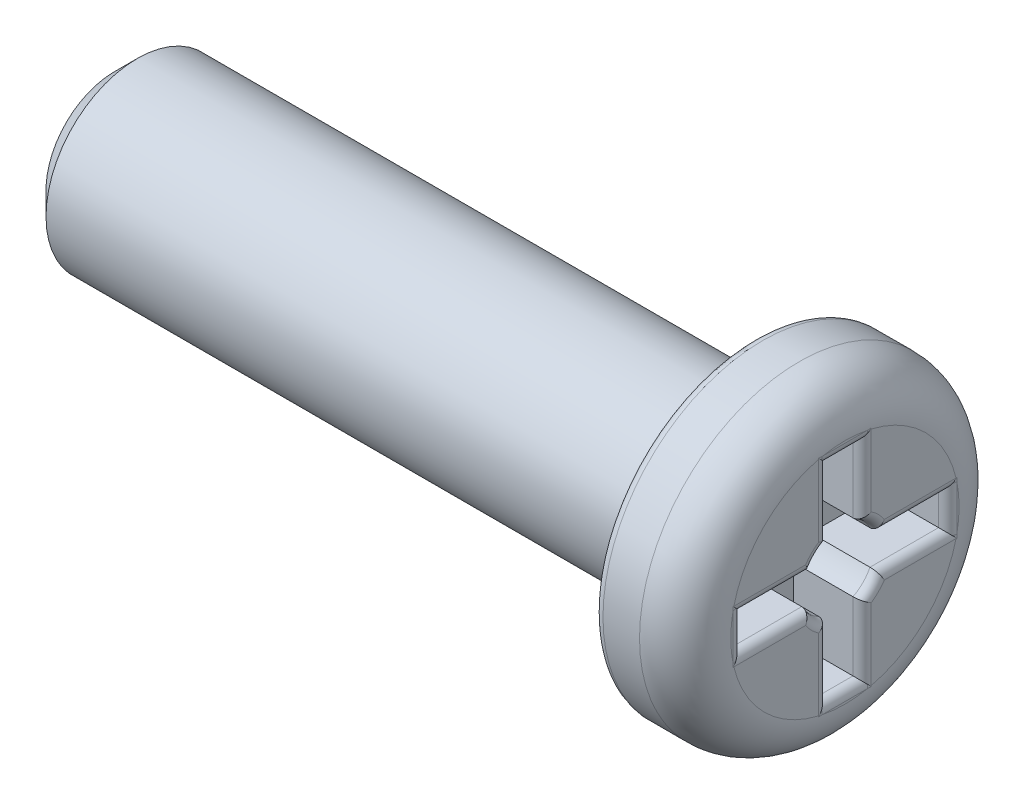
from build123d import *

# Parameters (mm, degrees)
ESQUISSE2_W                  = 0.75
ESQUISSE2_H                  = 2.25
ENL_V_MAT_EXTRU_1_DEPTH      = 1.5
R_P_TITION_CIRCULAIRE1_COUNT = 4
ESQUISSE3_R                  = 0.836492191
ENL_V_MAT_EXTRU_2_DEPTH      = 1.5
CONG_2_R                     = 0.2
CHANFREIN1_SIZE              = 0.5


with BuildPart() as part:
    # Esquisse1 → Révolution1 (revolve)
    with BuildSketch(Plane.XY, mode=Mode.PRIVATE) as r_volution1_sk:
        with BuildLine():
            Line((0, 0), (0, 2))
            Line((0, 2), (14, 2))
            Line((14, 2), (14, 3.5))
            Line((14, 3.5), (15, 3.5))
            ThreePointArc((15, 3.5), (15.707106781, 3.207106781), (16, 2.5))
            Line((16, 2.5), (16, 0))
            Line((16, 0), (0, 0))
        make_face()
    revolve(r_volution1_sk.sketch.rotate(Axis((0, 0, 0), (1, 0, 0)), 90), axis=Axis((0, 0, 0), (1, 0, 0)))

    # Esquisse2 → Enlèv. mat.-Extru.1 (cut)
    with BuildSketch(Plane(origin=(16, 0, 0), x_dir=(0, 0, -1), z_dir=(1, 0, 0))):
        with Locations((0, 1.125)):
            Rectangle(ESQUISSE2_W, ESQUISSE2_H)
    enl_v_mat_extru_1 = extrude(amount=-ENL_V_MAT_EXTRU_1_DEPTH, mode=Mode.SUBTRACT)

    # Répétition circulaire1: Enlèv. mat.-Extru.1 ×4 about axis
    r_p_tition_circulaire1_axis = Axis((0, 0, 0), (1, 0, 0))
    for i in range(1, R_P_TITION_CIRCULAIRE1_COUNT):
        add(enl_v_mat_extru_1.rotate(r_p_tition_circulaire1_axis, i * 360 / R_P_TITION_CIRCULAIRE1_COUNT), mode=Mode.SUBTRACT)

    # Esquisse3 → Enlèv. mat.-Extru.2 (cut)
    with BuildSketch(Plane(origin=(16, 0, 0), x_dir=(0, 0, -1), z_dir=(1, 0, 0))):
        Circle(ESQUISSE3_R)
    extrude(amount=-ENL_V_MAT_EXTRU_2_DEPTH, mode=Mode.SUBTRACT)

    # Congé2
    # the kernel refuses this fillet: 0.2 mm, written as the material it takes off along each edge
    with BuildSketch(Plane(origin=(14, 0, 0), x_dir=(0, 0, 1), z_dir=(0, 1, 0))) as cong_2_piece_1:
        with BuildLine():
            CenterArc((3.5 - CONG_2_R, CONG_2_R), CONG_2_R, 270, 90)
            Line((3.5, CONG_2_R), (3.5 + CONG_2_R * 0.02, CONG_2_R))
            Line((3.5 + CONG_2_R * 0.02, CONG_2_R), (3.5 + CONG_2_R * 0.02, -CONG_2_R * 0.02))
            Line((3.5 + CONG_2_R * 0.02, -CONG_2_R * 0.02), (3.5 - CONG_2_R, -CONG_2_R * 0.02))
            Line((3.5 - CONG_2_R, -CONG_2_R * 0.02), (3.5 - CONG_2_R, 0))
        make_face()
    revolve(axis=Axis((14, 0, 0), (1, 0, 0)), mode=Mode.SUBTRACT)
    with BuildSketch(Plane(origin=(16, -0.375, 2.25), x_dir=(0, 0, 1), z_dir=(0, 1, 0)), Plane(origin=(16, -2.25, -0.375), x_dir=(0, -1, 0), z_dir=(0, 0, 1)), Plane(origin=(16, 0.375, -2.25), x_dir=(0, 0, -1), z_dir=(0, -1, 0)), Plane(origin=(16, 2.25, 0.375), x_dir=(0, 1, 0), z_dir=(0, 0, -1))) as cong_2_piece_2:
        with BuildLine():
            CenterArc((CONG_2_R, -CONG_2_R), CONG_2_R, 90, 90)
            Line((0, -CONG_2_R), (-CONG_2_R * 0.02, -CONG_2_R))
            Line((-CONG_2_R * 0.02, -CONG_2_R), (-CONG_2_R * 0.02, CONG_2_R * 0.02))
            Line((-CONG_2_R * 0.02, CONG_2_R * 0.02), (CONG_2_R, CONG_2_R * 0.02))
            Line((CONG_2_R, CONG_2_R * 0.02), (CONG_2_R, 0))
        make_face()
    extrude(amount=0.75, mode=Mode.SUBTRACT)
    with BuildSketch(Plane(origin=(16, -0.375, 0.24772601), x_dir=(0, -1, 0), z_dir=(0, 0, 1)), Plane(origin=(16, -2.25, 0.375), x_dir=(0, 0, 1), z_dir=(0, 1, 0)), Plane(origin=(16, -0.24772601, -0.375), x_dir=(0, 0, -1), z_dir=(0, -1, 0)), Plane(origin=(16, -0.375, -2.25), x_dir=(0, -1, 0), z_dir=(0, 0, 1)), Plane(origin=(16, 0.375, -0.24772601), x_dir=(0, 1, 0), z_dir=(0, 0, -1)), Plane(origin=(16, 2.25, -0.375), x_dir=(0, 0, -1), z_dir=(0, -1, 0)), Plane(origin=(16, 0.24772601, 0.375), x_dir=(0, 0, 1), z_dir=(0, 1, 0)), Plane(origin=(16, 0.375, 2.25), x_dir=(0, 1, 0), z_dir=(0, 0, -1))) as cong_2_piece_3:
        with BuildLine():
            CenterArc((CONG_2_R, -CONG_2_R), CONG_2_R, 90, 90)
            Line((0, -CONG_2_R), (-CONG_2_R * 0.02, -CONG_2_R))
            Line((-CONG_2_R * 0.02, -CONG_2_R), (-CONG_2_R * 0.02, CONG_2_R * 0.02))
            Line((-CONG_2_R * 0.02, CONG_2_R * 0.02), (CONG_2_R, CONG_2_R * 0.02))
            Line((CONG_2_R, CONG_2_R * 0.02), (CONG_2_R, 0))
        make_face()
    extrude(amount=2.00227399, mode=Mode.SUBTRACT)
    with BuildSketch(Plane(origin=(16, 0, 0), x_dir=(0, 0.13251987061170517, 0.9911803488230871), z_dir=(0, 0.9911803488230871, -0.13251987061170517))) as cong_2_piece_4:
        with BuildLine():
            CenterArc((0.836492191 + CONG_2_R, -CONG_2_R), CONG_2_R, 90, 90)
            Line((0.836492191, -CONG_2_R), (0.836492191 - CONG_2_R * 0.02, -CONG_2_R))
            Line((0.836492191 - CONG_2_R * 0.02, -CONG_2_R), (0.836492191 - CONG_2_R * 0.02, CONG_2_R * 0.02))
            Line((0.836492191 - CONG_2_R * 0.02, CONG_2_R * 0.02), (0.836492191 + CONG_2_R, CONG_2_R * 0.02))
            Line((0.836492191 + CONG_2_R, CONG_2_R * 0.02), (0.836492191 + CONG_2_R, 0))
        make_face()
    revolve(axis=Axis((16, 0, 0), (1, 0, 0)), revolution_arc=105.230460742, mode=Mode.SUBTRACT)
    with BuildSketch(Plane(origin=(16, 0, 0), x_dir=(0, -0.9911803488230848, 0.1325198706117237), z_dir=(0, 0.1325198706117237, 0.9911803488230848))) as cong_2_piece_5:
        with BuildLine():
            CenterArc((0.836492191 + CONG_2_R, -CONG_2_R), CONG_2_R, 90, 90)
            Line((0.836492191, -CONG_2_R), (0.836492191 - CONG_2_R * 0.02, -CONG_2_R))
            Line((0.836492191 - CONG_2_R * 0.02, -CONG_2_R), (0.836492191 - CONG_2_R * 0.02, CONG_2_R * 0.02))
            Line((0.836492191 - CONG_2_R * 0.02, CONG_2_R * 0.02), (0.836492191 + CONG_2_R, CONG_2_R * 0.02))
            Line((0.836492191 + CONG_2_R, CONG_2_R * 0.02), (0.836492191 + CONG_2_R, 0))
        make_face()
    revolve(axis=Axis((16, 0, 0), (1, 0, 0)), revolution_arc=105.230460742, mode=Mode.SUBTRACT)
    with BuildSketch(Plane(origin=(16, 0, 0), x_dir=(0, -0.13251987061172962, -0.991180348823084), z_dir=(0, -0.991180348823084, 0.13251987061172962))) as cong_2_piece_6:
        with BuildLine():
            CenterArc((0.836492191 + CONG_2_R, -CONG_2_R), CONG_2_R, 90, 90)
            Line((0.836492191, -CONG_2_R), (0.836492191 - CONG_2_R * 0.02, -CONG_2_R))
            Line((0.836492191 - CONG_2_R * 0.02, -CONG_2_R), (0.836492191 - CONG_2_R * 0.02, CONG_2_R * 0.02))
            Line((0.836492191 - CONG_2_R * 0.02, CONG_2_R * 0.02), (0.836492191 + CONG_2_R, CONG_2_R * 0.02))
            Line((0.836492191 + CONG_2_R, CONG_2_R * 0.02), (0.836492191 + CONG_2_R, 0))
        make_face()
    revolve(axis=Axis((16, 0, 0), (1, 0, 0)), revolution_arc=105.230460742, mode=Mode.SUBTRACT)
    with BuildSketch(Plane(origin=(16, 0, 0), x_dir=(0, 0.9911803488230839, -0.13251987061173062), z_dir=(0, -0.13251987061173062, -0.9911803488230839))) as cong_2_piece_7:
        with BuildLine():
            CenterArc((0.836492191 + CONG_2_R, -CONG_2_R), CONG_2_R, 90, 90)
            Line((0.836492191, -CONG_2_R), (0.836492191 - CONG_2_R * 0.02, -CONG_2_R))
            Line((0.836492191 - CONG_2_R * 0.02, -CONG_2_R), (0.836492191 - CONG_2_R * 0.02, CONG_2_R * 0.02))
            Line((0.836492191 - CONG_2_R * 0.02, CONG_2_R * 0.02), (0.836492191 + CONG_2_R, CONG_2_R * 0.02))
            Line((0.836492191 + CONG_2_R, CONG_2_R * 0.02), (0.836492191 + CONG_2_R, 0))
        make_face()
    revolve(axis=Axis((16, 0, 0), (1, 0, 0)), revolution_arc=105.230460742, mode=Mode.SUBTRACT)
    with BuildSketch(Plane(origin=(16, -0.875, 2.25), x_dir=(0, 0, 1), z_dir=(0, 1, 0))) as cong_2_piece_8a_section:
        with BuildLine():
            CenterArc((CONG_2_R, -CONG_2_R), CONG_2_R, 90, 90)
            Line((0, -CONG_2_R), (-CONG_2_R * 0.02, -CONG_2_R))
            Line((-CONG_2_R * 0.02, -CONG_2_R), (-CONG_2_R * 0.02, CONG_2_R * 0.02))
            Line((-CONG_2_R * 0.02, CONG_2_R * 0.02), (CONG_2_R, CONG_2_R * 0.02))
            Line((CONG_2_R, CONG_2_R * 0.02), (CONG_2_R, 0))
        make_face()
    cong_2_piece_8a = extrude(amount=1.25, mode=Mode.PRIVATE)
    cong_2_piece_8a = split(cong_2_piece_8a, bisect_by=Plane(origin=(15.954720977, -0.375, 2.295279023), z_dir=(0, -1, 0)), keep=Keep.TOP, mode=Mode.PRIVATE)
    with BuildSketch(Plane(origin=(16, -0.375, 0.24772601), x_dir=(0, -1, 0), z_dir=(0, 0, 1))) as cong_2_piece_8b_section:
        with BuildLine():
            CenterArc((CONG_2_R, -CONG_2_R), CONG_2_R, 90, 90)
            Line((0, -CONG_2_R), (-CONG_2_R * 0.02, -CONG_2_R))
            Line((-CONG_2_R * 0.02, -CONG_2_R), (-CONG_2_R * 0.02, CONG_2_R * 0.02))
            Line((-CONG_2_R * 0.02, CONG_2_R * 0.02), (CONG_2_R, CONG_2_R * 0.02))
            Line((CONG_2_R, CONG_2_R * 0.02), (CONG_2_R, 0))
        make_face()
    cong_2_piece_8b = extrude(amount=2.50227399, mode=Mode.PRIVATE)
    cong_2_piece_8b = split(cong_2_piece_8b, bisect_by=Plane(origin=(15.954720977, -0.420279023, 2.25), z_dir=(0, 0, 1)), keep=Keep.TOP, mode=Mode.PRIVATE)
    cong_2_piece_8 = cong_2_piece_8a & cong_2_piece_8b
    add(cong_2_piece_8, mode=Mode.SUBTRACT)
    with BuildSketch(Plane(origin=(16, -0.375, 2.25), x_dir=(0, 0, 1), z_dir=(0, 1, 0))) as cong_2_piece_9a_section:
        with BuildLine():
            CenterArc((CONG_2_R, -CONG_2_R), CONG_2_R, 90, 90)
            Line((0, -CONG_2_R), (-CONG_2_R * 0.02, -CONG_2_R))
            Line((-CONG_2_R * 0.02, -CONG_2_R), (-CONG_2_R * 0.02, CONG_2_R * 0.02))
            Line((-CONG_2_R * 0.02, CONG_2_R * 0.02), (CONG_2_R, CONG_2_R * 0.02))
            Line((CONG_2_R, CONG_2_R * 0.02), (CONG_2_R, 0))
        make_face()
    cong_2_piece_9a = extrude(amount=1.25, mode=Mode.PRIVATE)
    cong_2_piece_9a = split(cong_2_piece_9a, bisect_by=Plane(origin=(15.954720977, 0.375, 2.295279023), z_dir=(0, 1, 0)), keep=Keep.TOP, mode=Mode.PRIVATE)
    with BuildSketch(Plane(origin=(16, 0.375, 2.75), x_dir=(0, 1, 0), z_dir=(0, 0, -1))) as cong_2_piece_9b_section:
        with BuildLine():
            CenterArc((CONG_2_R, -CONG_2_R), CONG_2_R, 90, 90)
            Line((0, -CONG_2_R), (-CONG_2_R * 0.02, -CONG_2_R))
            Line((-CONG_2_R * 0.02, -CONG_2_R), (-CONG_2_R * 0.02, CONG_2_R * 0.02))
            Line((-CONG_2_R * 0.02, CONG_2_R * 0.02), (CONG_2_R, CONG_2_R * 0.02))
            Line((CONG_2_R, CONG_2_R * 0.02), (CONG_2_R, 0))
        make_face()
    cong_2_piece_9b = extrude(amount=2.50227399, mode=Mode.PRIVATE)
    cong_2_piece_9b = split(cong_2_piece_9b, bisect_by=Plane(origin=(15.954720977, 0.420279023, 2.25), z_dir=(0, 0, 1)), keep=Keep.TOP, mode=Mode.PRIVATE)
    cong_2_piece_9 = cong_2_piece_9a & cong_2_piece_9b
    add(cong_2_piece_9, mode=Mode.SUBTRACT)
    with BuildSketch(Plane(origin=(16, -2.75, 0.375), x_dir=(0, 0, 1), z_dir=(0, 1, 0))) as cong_2_piece_10a_section:
        with BuildLine():
            CenterArc((CONG_2_R, -CONG_2_R), CONG_2_R, 90, 90)
            Line((0, -CONG_2_R), (-CONG_2_R * 0.02, -CONG_2_R))
            Line((-CONG_2_R * 0.02, -CONG_2_R), (-CONG_2_R * 0.02, CONG_2_R * 0.02))
            Line((-CONG_2_R * 0.02, CONG_2_R * 0.02), (CONG_2_R, CONG_2_R * 0.02))
            Line((CONG_2_R, CONG_2_R * 0.02), (CONG_2_R, 0))
        make_face()
    cong_2_piece_10a = extrude(amount=2.50227399, mode=Mode.PRIVATE)
    cong_2_piece_10a = split(cong_2_piece_10a, bisect_by=Plane(origin=(15.954720977, -2.25, 0.420279023), z_dir=(0, -1, 0)), keep=Keep.TOP, mode=Mode.PRIVATE)
    with BuildSketch(Plane(origin=(16, -2.25, -0.375), x_dir=(0, -1, 0), z_dir=(0, 0, 1))) as cong_2_piece_10b_section:
        with BuildLine():
            CenterArc((CONG_2_R, -CONG_2_R), CONG_2_R, 90, 90)
            Line((0, -CONG_2_R), (-CONG_2_R * 0.02, -CONG_2_R))
            Line((-CONG_2_R * 0.02, -CONG_2_R), (-CONG_2_R * 0.02, CONG_2_R * 0.02))
            Line((-CONG_2_R * 0.02, CONG_2_R * 0.02), (CONG_2_R, CONG_2_R * 0.02))
            Line((CONG_2_R, CONG_2_R * 0.02), (CONG_2_R, 0))
        make_face()
    cong_2_piece_10b = extrude(amount=1.25, mode=Mode.PRIVATE)
    cong_2_piece_10b = split(cong_2_piece_10b, bisect_by=Plane(origin=(15.954720977, -2.295279023, 0.375), z_dir=(0, 0, 1)), keep=Keep.TOP, mode=Mode.PRIVATE)
    cong_2_piece_10 = cong_2_piece_10a & cong_2_piece_10b
    add(cong_2_piece_10, mode=Mode.SUBTRACT)
    with BuildSketch(Plane(origin=(16, -2.25, -0.875), x_dir=(0, -1, 0), z_dir=(0, 0, 1))) as cong_2_piece_11a_section:
        with BuildLine():
            CenterArc((CONG_2_R, -CONG_2_R), CONG_2_R, 90, 90)
            Line((0, -CONG_2_R), (-CONG_2_R * 0.02, -CONG_2_R))
            Line((-CONG_2_R * 0.02, -CONG_2_R), (-CONG_2_R * 0.02, CONG_2_R * 0.02))
            Line((-CONG_2_R * 0.02, CONG_2_R * 0.02), (CONG_2_R, CONG_2_R * 0.02))
            Line((CONG_2_R, CONG_2_R * 0.02), (CONG_2_R, 0))
        make_face()
    cong_2_piece_11a = extrude(amount=1.25, mode=Mode.PRIVATE)
    cong_2_piece_11a = split(cong_2_piece_11a, bisect_by=Plane(origin=(15.954720977, -2.295279023, -0.375), z_dir=(0, 0, -1)), keep=Keep.TOP, mode=Mode.PRIVATE)
    with BuildSketch(Plane(origin=(16, -0.24772601, -0.375), x_dir=(0, 0, -1), z_dir=(0, -1, 0))) as cong_2_piece_11b_section:
        with BuildLine():
            CenterArc((CONG_2_R, -CONG_2_R), CONG_2_R, 90, 90)
            Line((0, -CONG_2_R), (-CONG_2_R * 0.02, -CONG_2_R))
            Line((-CONG_2_R * 0.02, -CONG_2_R), (-CONG_2_R * 0.02, CONG_2_R * 0.02))
            Line((-CONG_2_R * 0.02, CONG_2_R * 0.02), (CONG_2_R, CONG_2_R * 0.02))
            Line((CONG_2_R, CONG_2_R * 0.02), (CONG_2_R, 0))
        make_face()
    cong_2_piece_11b = extrude(amount=2.50227399, mode=Mode.PRIVATE)
    cong_2_piece_11b = split(cong_2_piece_11b, bisect_by=Plane(origin=(15.954720977, -2.25, -0.420279023), z_dir=(0, -1, 0)), keep=Keep.TOP, mode=Mode.PRIVATE)
    cong_2_piece_11 = cong_2_piece_11a & cong_2_piece_11b
    add(cong_2_piece_11, mode=Mode.SUBTRACT)
    with BuildSketch(Plane(origin=(16, -0.375, -2.75), x_dir=(0, -1, 0), z_dir=(0, 0, 1))) as cong_2_piece_12a_section:
        with BuildLine():
            CenterArc((CONG_2_R, -CONG_2_R), CONG_2_R, 90, 90)
            Line((0, -CONG_2_R), (-CONG_2_R * 0.02, -CONG_2_R))
            Line((-CONG_2_R * 0.02, -CONG_2_R), (-CONG_2_R * 0.02, CONG_2_R * 0.02))
            Line((-CONG_2_R * 0.02, CONG_2_R * 0.02), (CONG_2_R, CONG_2_R * 0.02))
            Line((CONG_2_R, CONG_2_R * 0.02), (CONG_2_R, 0))
        make_face()
    cong_2_piece_12a = extrude(amount=2.50227399, mode=Mode.PRIVATE)
    cong_2_piece_12a = split(cong_2_piece_12a, bisect_by=Plane(origin=(15.954720977, -0.420279023, -2.25), z_dir=(0, 0, -1)), keep=Keep.TOP, mode=Mode.PRIVATE)
    with BuildSketch(Plane(origin=(16, 0.375, -2.25), x_dir=(0, 0, -1), z_dir=(0, -1, 0))) as cong_2_piece_12b_section:
        with BuildLine():
            CenterArc((CONG_2_R, -CONG_2_R), CONG_2_R, 90, 90)
            Line((0, -CONG_2_R), (-CONG_2_R * 0.02, -CONG_2_R))
            Line((-CONG_2_R * 0.02, -CONG_2_R), (-CONG_2_R * 0.02, CONG_2_R * 0.02))
            Line((-CONG_2_R * 0.02, CONG_2_R * 0.02), (CONG_2_R, CONG_2_R * 0.02))
            Line((CONG_2_R, CONG_2_R * 0.02), (CONG_2_R, 0))
        make_face()
    cong_2_piece_12b = extrude(amount=1.25, mode=Mode.PRIVATE)
    cong_2_piece_12b = split(cong_2_piece_12b, bisect_by=Plane(origin=(15.954720977, -0.375, -2.295279023), z_dir=(0, -1, 0)), keep=Keep.TOP, mode=Mode.PRIVATE)
    cong_2_piece_12 = cong_2_piece_12a & cong_2_piece_12b
    add(cong_2_piece_12, mode=Mode.SUBTRACT)
    with BuildSketch(Plane(origin=(16, 0.875, -2.25), x_dir=(0, 0, -1), z_dir=(0, -1, 0))) as cong_2_piece_13a_section:
        with BuildLine():
            CenterArc((CONG_2_R, -CONG_2_R), CONG_2_R, 90, 90)
            Line((0, -CONG_2_R), (-CONG_2_R * 0.02, -CONG_2_R))
            Line((-CONG_2_R * 0.02, -CONG_2_R), (-CONG_2_R * 0.02, CONG_2_R * 0.02))
            Line((-CONG_2_R * 0.02, CONG_2_R * 0.02), (CONG_2_R, CONG_2_R * 0.02))
            Line((CONG_2_R, CONG_2_R * 0.02), (CONG_2_R, 0))
        make_face()
    cong_2_piece_13a = extrude(amount=1.25, mode=Mode.PRIVATE)
    cong_2_piece_13a = split(cong_2_piece_13a, bisect_by=Plane(origin=(15.954720977, 0.375, -2.295279023), z_dir=(0, 1, 0)), keep=Keep.TOP, mode=Mode.PRIVATE)
    with BuildSketch(Plane(origin=(16, 0.375, -0.24772601), x_dir=(0, 1, 0), z_dir=(0, 0, -1))) as cong_2_piece_13b_section:
        with BuildLine():
            CenterArc((CONG_2_R, -CONG_2_R), CONG_2_R, 90, 90)
            Line((0, -CONG_2_R), (-CONG_2_R * 0.02, -CONG_2_R))
            Line((-CONG_2_R * 0.02, -CONG_2_R), (-CONG_2_R * 0.02, CONG_2_R * 0.02))
            Line((-CONG_2_R * 0.02, CONG_2_R * 0.02), (CONG_2_R, CONG_2_R * 0.02))
            Line((CONG_2_R, CONG_2_R * 0.02), (CONG_2_R, 0))
        make_face()
    cong_2_piece_13b = extrude(amount=2.50227399, mode=Mode.PRIVATE)
    cong_2_piece_13b = split(cong_2_piece_13b, bisect_by=Plane(origin=(15.954720977, 0.420279023, -2.25), z_dir=(0, 0, -1)), keep=Keep.TOP, mode=Mode.PRIVATE)
    cong_2_piece_13 = cong_2_piece_13a & cong_2_piece_13b
    add(cong_2_piece_13, mode=Mode.SUBTRACT)
    with BuildSketch(Plane(origin=(16, 2.75, -0.375), x_dir=(0, 0, -1), z_dir=(0, -1, 0))) as cong_2_piece_14a_section:
        with BuildLine():
            CenterArc((CONG_2_R, -CONG_2_R), CONG_2_R, 90, 90)
            Line((0, -CONG_2_R), (-CONG_2_R * 0.02, -CONG_2_R))
            Line((-CONG_2_R * 0.02, -CONG_2_R), (-CONG_2_R * 0.02, CONG_2_R * 0.02))
            Line((-CONG_2_R * 0.02, CONG_2_R * 0.02), (CONG_2_R, CONG_2_R * 0.02))
            Line((CONG_2_R, CONG_2_R * 0.02), (CONG_2_R, 0))
        make_face()
    cong_2_piece_14a = extrude(amount=2.50227399, mode=Mode.PRIVATE)
    cong_2_piece_14a = split(cong_2_piece_14a, bisect_by=Plane(origin=(15.954720977, 2.25, -0.420279023), z_dir=(0, 1, 0)), keep=Keep.TOP, mode=Mode.PRIVATE)
    with BuildSketch(Plane(origin=(16, 2.25, 0.375), x_dir=(0, 1, 0), z_dir=(0, 0, -1))) as cong_2_piece_14b_section:
        with BuildLine():
            CenterArc((CONG_2_R, -CONG_2_R), CONG_2_R, 90, 90)
            Line((0, -CONG_2_R), (-CONG_2_R * 0.02, -CONG_2_R))
            Line((-CONG_2_R * 0.02, -CONG_2_R), (-CONG_2_R * 0.02, CONG_2_R * 0.02))
            Line((-CONG_2_R * 0.02, CONG_2_R * 0.02), (CONG_2_R, CONG_2_R * 0.02))
            Line((CONG_2_R, CONG_2_R * 0.02), (CONG_2_R, 0))
        make_face()
    cong_2_piece_14b = extrude(amount=1.25, mode=Mode.PRIVATE)
    cong_2_piece_14b = split(cong_2_piece_14b, bisect_by=Plane(origin=(15.954720977, 2.295279023, -0.375), z_dir=(0, 0, -1)), keep=Keep.TOP, mode=Mode.PRIVATE)
    cong_2_piece_14 = cong_2_piece_14a & cong_2_piece_14b
    add(cong_2_piece_14, mode=Mode.SUBTRACT)
    with BuildSketch(Plane(origin=(16, 2.25, 0.875), x_dir=(0, 1, 0), z_dir=(0, 0, -1))) as cong_2_piece_15a_section:
        with BuildLine():
            CenterArc((CONG_2_R, -CONG_2_R), CONG_2_R, 90, 90)
            Line((0, -CONG_2_R), (-CONG_2_R * 0.02, -CONG_2_R))
            Line((-CONG_2_R * 0.02, -CONG_2_R), (-CONG_2_R * 0.02, CONG_2_R * 0.02))
            Line((-CONG_2_R * 0.02, CONG_2_R * 0.02), (CONG_2_R, CONG_2_R * 0.02))
            Line((CONG_2_R, CONG_2_R * 0.02), (CONG_2_R, 0))
        make_face()
    cong_2_piece_15a = extrude(amount=1.25, mode=Mode.PRIVATE)
    cong_2_piece_15a = split(cong_2_piece_15a, bisect_by=Plane(origin=(15.954720977, 2.295279023, 0.375), z_dir=(0, 0, 1)), keep=Keep.TOP, mode=Mode.PRIVATE)
    with BuildSketch(Plane(origin=(16, 0.24772601, 0.375), x_dir=(0, 0, 1), z_dir=(0, 1, 0))) as cong_2_piece_15b_section:
        with BuildLine():
            CenterArc((CONG_2_R, -CONG_2_R), CONG_2_R, 90, 90)
            Line((0, -CONG_2_R), (-CONG_2_R * 0.02, -CONG_2_R))
            Line((-CONG_2_R * 0.02, -CONG_2_R), (-CONG_2_R * 0.02, CONG_2_R * 0.02))
            Line((-CONG_2_R * 0.02, CONG_2_R * 0.02), (CONG_2_R, CONG_2_R * 0.02))
            Line((CONG_2_R, CONG_2_R * 0.02), (CONG_2_R, 0))
        make_face()
    cong_2_piece_15b = extrude(amount=2.50227399, mode=Mode.PRIVATE)
    cong_2_piece_15b = split(cong_2_piece_15b, bisect_by=Plane(origin=(15.954720977, 2.25, 0.420279023), z_dir=(0, 1, 0)), keep=Keep.TOP, mode=Mode.PRIVATE)
    cong_2_piece_15 = cong_2_piece_15a & cong_2_piece_15b
    add(cong_2_piece_15, mode=Mode.SUBTRACT)

    # Chanfrein1
    chanfrein1_edges = [part.edges().sort_by_distance(p)[0] for p in [
        (0, 0, -2),
    ]]
    chamfer(chanfrein1_edges, length=CHANFREIN1_SIZE)


solid = part.part
